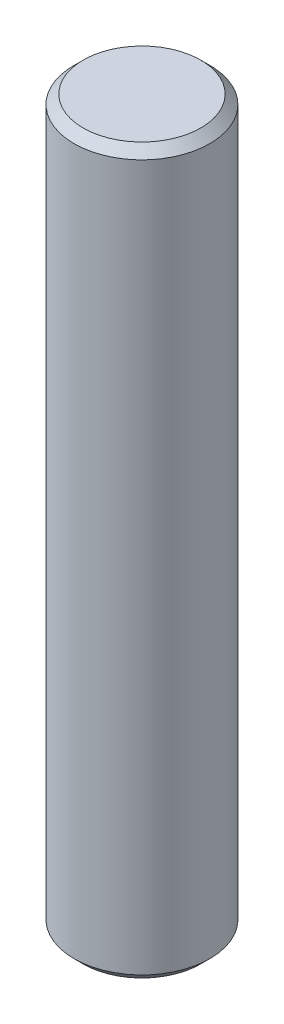
from build123d import *

# Parameters (mm, degrees)
SKETCH1_R           = 0.75
BOSS_EXTRUDE1_DEPTH = 8
CHAMFER1_SIZE       = 0.1


with BuildPart() as part:
    # Sketch1 → Boss-Extrude1 (new body)
    with BuildSketch(Plane(origin=(0, 0, 0), x_dir=(1, 0, 0), z_dir=(0, 1, 0))):
        Circle(SKETCH1_R)
    extrude(amount=BOSS_EXTRUDE1_DEPTH)

    # Chamfer1
    chamfer1_edges = [part.edges().sort_by_distance(p)[0] for p in [
        (-0.75, 0, 0),
        (-0.75, 8, 0),
    ]]
    chamfer(chamfer1_edges, length=CHAMFER1_SIZE)


solid = part.part
